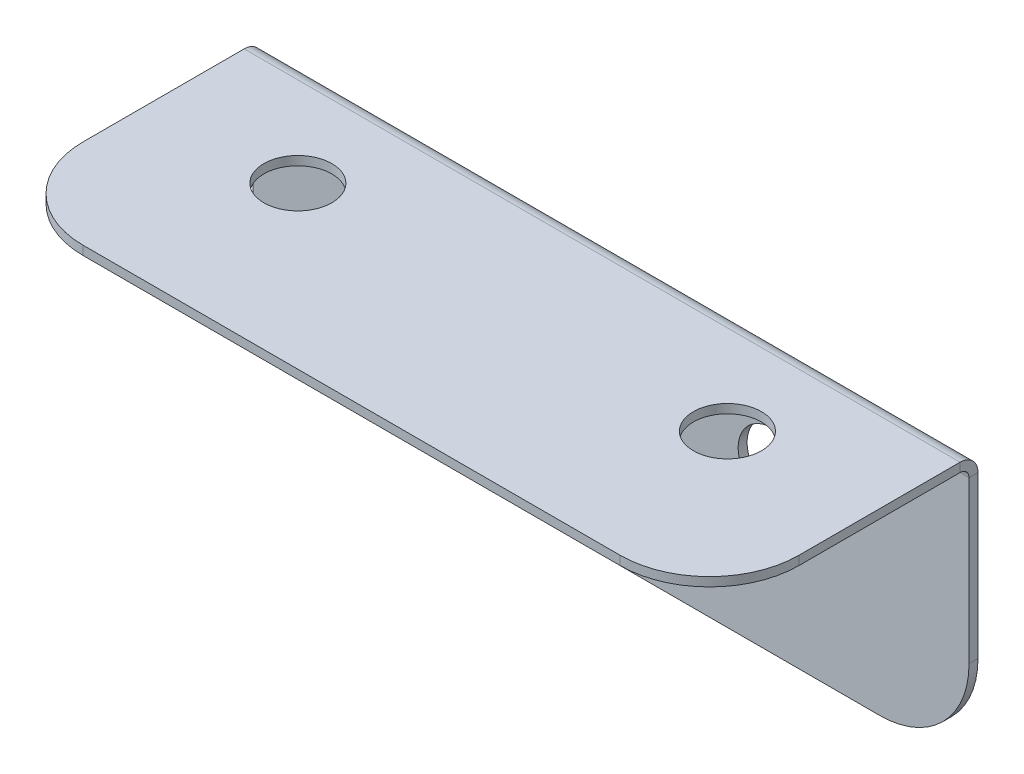
from build123d import *

# Parameters (mm, degrees)
SKETCH1_W                    = 40
SKETCH1_H                    = 15
BASE_FLANGE1_DEPTH           = 0.5
EDGE_FLANGE1_STRIP_W         = 3
EDGE_FLANGE1_STRIP_H         = 0.5
EDGE_FLANGE1_STRIP_CUT_DEPTH = 40
EDGE_FLANGE1_DEPTH           = 40
F_6_CLEARANCE_HOLE2_D        = 3.7973
F_6_CLEARANCE_HOLE2_DEPTH    = 10
F_6_CLEARANCE_HOLE2_TIP      = 1.140824014
F_6_CLEARANCE_HOLE3_D        = 3.7973
BREAK_CORNER1_START          = -10
BREAK_CORNER1_DEPTH          = 0.5
BREAK_CORNER1_START_2        = -0.5
BREAK_CORNER1_2_DEPTH        = 0.5


# Read off the part's stored shape, not the designer's step: Break-Corner1
# Sheet-metal steps are written as plain solids
with BuildPart() as part:
    # Sketch1 → Base-Flange1 (new body)
    with BuildSketch(Plane(origin=(0, 0, 0), x_dir=(1, 0, 0), z_dir=(0, 1, 0))):
        with Locations((0, 2.5)):
            Rectangle(SKETCH1_W, SKETCH1_H)
    extrude(amount=-BASE_FLANGE1_DEPTH)

    # Edge-Flange1 strip (across the edge) → Edge-Flange1 strip cut (cut)
    with BuildSketch(Plane(origin=(-20, -0.5, -10), x_dir=(0, 0, 1), z_dir=(1, 0, 0))):
        with Locations((-0.5, -0.25)):
            Rectangle(EDGE_FLANGE1_STRIP_W, EDGE_FLANGE1_STRIP_H)
    extrude(amount=EDGE_FLANGE1_STRIP_CUT_DEPTH, mode=Mode.SUBTRACT)

    # Edge-Flange1 section (across the edge) → Edge-Flange1 (add)
    with BuildSketch(Plane(origin=(-20, -0.5, -10), x_dir=(0, 0, 1), z_dir=(1, 0, 0))):
        with BuildLine():
            Line((0, 0.5), (0, 14.5))
            Line((0, 14.5), (0.5, 14.5))
            Line((0.5, 14.5), (0.5, 0.5))
            ThreePointArc((0.5, 0.5), (0.646446609, 0.146446609), (1, 0))
            Line((1, 0), (1, -0.5))
            ThreePointArc((1, -0.5), (0.292893219, -0.207106781), (0, 0.5))
        make_face()
    extrude(amount=EDGE_FLANGE1_DEPTH)

    # #6 Clearance Hole2
    with Locations(Plane.XY.offset(-9.5)):
        with Locations((-9, -6), (9, -6)):
            Hole(F_6_CLEARANCE_HOLE2_D / 2, depth=F_6_CLEARANCE_HOLE2_DEPTH)
            with Locations((0, 0, -(F_6_CLEARANCE_HOLE2_DEPTH + F_6_CLEARANCE_HOLE2_TIP / 2))):  # 118° drill point
                Cone(0, F_6_CLEARANCE_HOLE2_D / 2, F_6_CLEARANCE_HOLE2_TIP, mode=Mode.SUBTRACT)

    # #6 Clearance Hole3 (through all)
    with Locations(Plane(origin=(0, 0, 0), x_dir=(1, 0, 0), z_dir=(0, 1, 0))):
        with Locations((12, 4), (-12, 4)):
            Hole(F_6_CLEARANCE_HOLE3_D / 2)

    # Break-Corner1 outline → Break-Corner1 (cut)
    with BuildSketch(Plane.XY.offset(BREAK_CORNER1_START)):
        with BuildLine():
            Line((-20, -15), (-15, -15))
            ThreePointArc((-15, -15), (-18.535533906, -13.535533906), (-20, -10))
            Line((-20, -10), (-20, -15))
        make_face()
        with BuildLine():
            ThreePointArc((20, -10), (18.535533906, -13.535533906), (15, -15))
            Line((15, -15), (20, -15))
            Line((20, -15), (20, -10))
        make_face()
    extrude(amount=BREAK_CORNER1_DEPTH, mode=Mode.SUBTRACT)

    # Break-Corner1 2 outline → Break-Corner1 2 (cut)
    with BuildSketch(Plane(origin=(0, 0, 0), x_dir=(1, 0, 0), z_dir=(0, 1, 0)).offset(BREAK_CORNER1_START_2)):
        with BuildLine():
            ThreePointArc((20, 0), (18.535533906, -3.535533906), (15, -5))
            Line((15, -5), (20, -5))
            Line((20, -5), (20, 0))
        make_face()
        with BuildLine():
            ThreePointArc((-15, -5), (-18.535533906, -3.535533906), (-20, 0))
            Line((-20, 0), (-20, -5))
            Line((-20, -5), (-15, -5))
        make_face()
    extrude(amount=BREAK_CORNER1_2_DEPTH, mode=Mode.SUBTRACT)


solid = part.part
